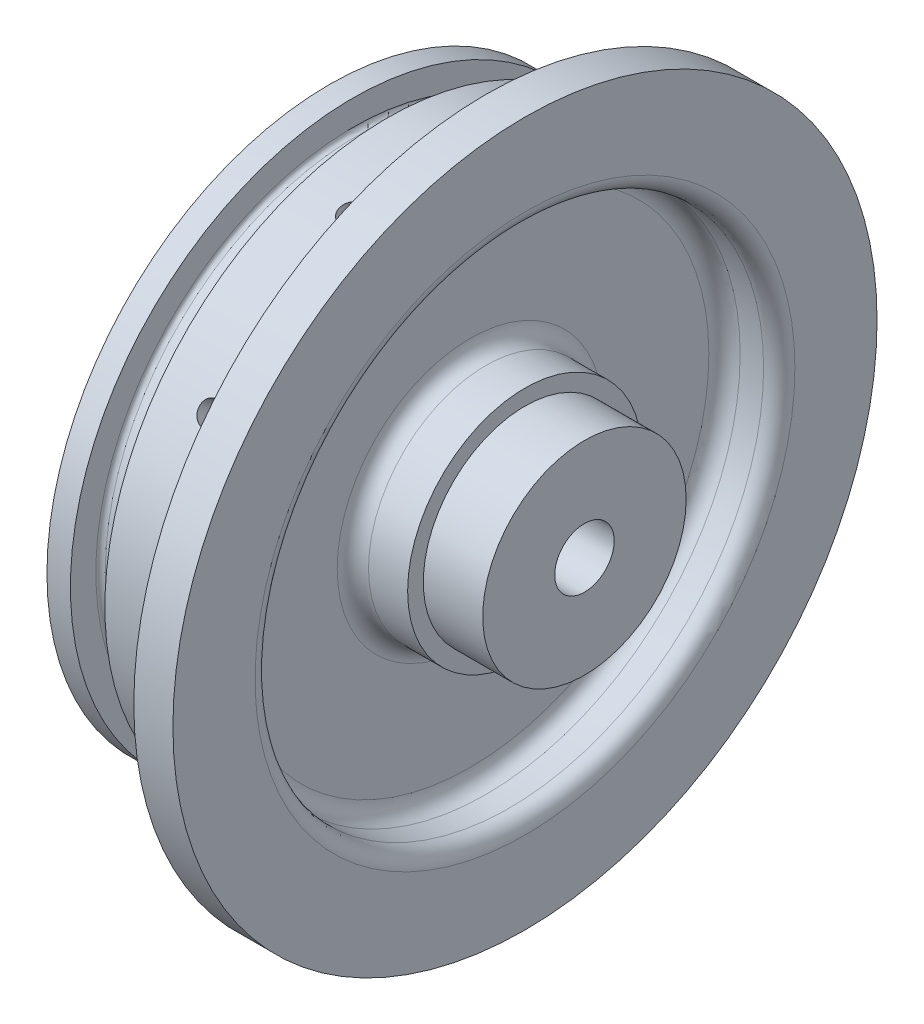
from build123d import *

# Parameters (mm, degrees)
SKETCH1_R           = 57.15
BOSS_EXTRUDE1_DEPTH = 6.35
SKETCH2_R           = 45.847
BOSS_EXTRUDE2_DEPTH = 25.4
SKETCH11_R          = 1.89865
CUT_EXTRUDE3_DEPTH  = 10.16
CIRPATTERN1_COUNT   = 10
SKETCH15_R          = 4.826
CUT_EXTRUDE4_DEPTH  = 87.83494404
BOSS_EXTRUDE3_START = 9.652
SKETCH17_R          = 16.51
SKETCH17_R_2        = 4.826
BOSS_EXTRUDE3_DEPTH = 9.652
SKETCH18_W          = 8.89
SKETCH18_H          = 22.225
FILLET1_R           = 2.54


with BuildPart() as part:
    # Sketch1 → Boss-Extrude1 (new body)
    with BuildSketch(Plane(origin=(0, 0, 0), x_dir=(0, 0, -1), z_dir=(1, 0, 0))):
        Circle(SKETCH1_R)
    extrude(amount=BOSS_EXTRUDE1_DEPTH)

    # Sketch2 → Boss-Extrude2 (add)
    with BuildSketch(Plane.ZY):
        Circle(SKETCH2_R)
    extrude(amount=BOSS_EXTRUDE2_DEPTH)

    # Sketch11 → Cut-Extrude3 (cut)
    with BuildSketch(Plane(origin=(0, 0, -45.847), x_dir=(-1, 0, 0), z_dir=(0, 0, -1))):
        with Locations((7.62, 0)):
            Circle(SKETCH11_R)
    cut_extrude3 = extrude(amount=-CUT_EXTRUDE3_DEPTH, mode=Mode.SUBTRACT)

    # CirPattern1: Cut-Extrude3 ×10 about axis
    cirpattern1_axis = Axis((0, 0, 0), (-1, 0, 0))
    for i in range(1, CIRPATTERN1_COUNT):
        add(cut_extrude3.rotate(cirpattern1_axis, i * 360 / CIRPATTERN1_COUNT), mode=Mode.SUBTRACT)

    # Sketch15 → Cut-Extrude4 (cut, through all)
    with BuildSketch(Plane(origin=(6.35, 0, 0), x_dir=(0, 0, -1), z_dir=(1, 0, 0))):
        Circle(SKETCH15_R)
    extrude(amount=-CUT_EXTRUDE4_DEPTH, mode=Mode.SUBTRACT)

    # Sketch16 → Cut-Revolve1 (revolve, cut)
    with BuildSketch(Plane.XY):
        with BuildLine():
            Line((-21.59, 45.847), (-16.002, 45.847))
            Line((-16.002, 45.847), (-16.002, 41.7195))
            ThreePointArc((-16.002, 41.7195), (-16.225184633, 41.180684633), (-16.764, 40.9575))
            Line((-16.764, 40.9575), (-20.828, 40.9575))
            ThreePointArc((-20.828, 40.9575), (-21.366815367, 41.180684633), (-21.59, 41.7195))
            Line((-21.59, 41.7195), (-21.59, 45.847))
        make_face()
    revolve(axis=Axis((0, 0, 0), (-1, 0, 0)), mode=Mode.SUBTRACT)

    # Sketch17 → Boss-Extrude3 (add)
    with BuildSketch(Plane(origin=(6.35, 0, 0), x_dir=(0, 0, -1), z_dir=(1, 0, 0)).offset(BOSS_EXTRUDE3_START)):
        Circle(SKETCH17_R)
        Circle(SKETCH17_R_2, mode=Mode.SUBTRACT)
    extrude(amount=-BOSS_EXTRUDE3_DEPTH)

    # Sketch18 → Cut-Revolve2 (revolve, cut)
    with BuildSketch(Plane.XY):
        with Locations((1.905, 30.1625)):
            Rectangle(SKETCH18_W, SKETCH18_H)
    revolve(axis=Axis((0, 0, 0), (-1, 0, 0)), mode=Mode.SUBTRACT)

    # Fillet1
    fillet1_edges = [part.edges().sort_by_distance(p)[0] for p in [
        (6.35, -41.275, 0),
        (-2.54, -41.275, 0),
        (-2.54, -19.05, 0),
    ]]
    fillet(fillet1_edges, radius=FILLET1_R)


solid = part.part
